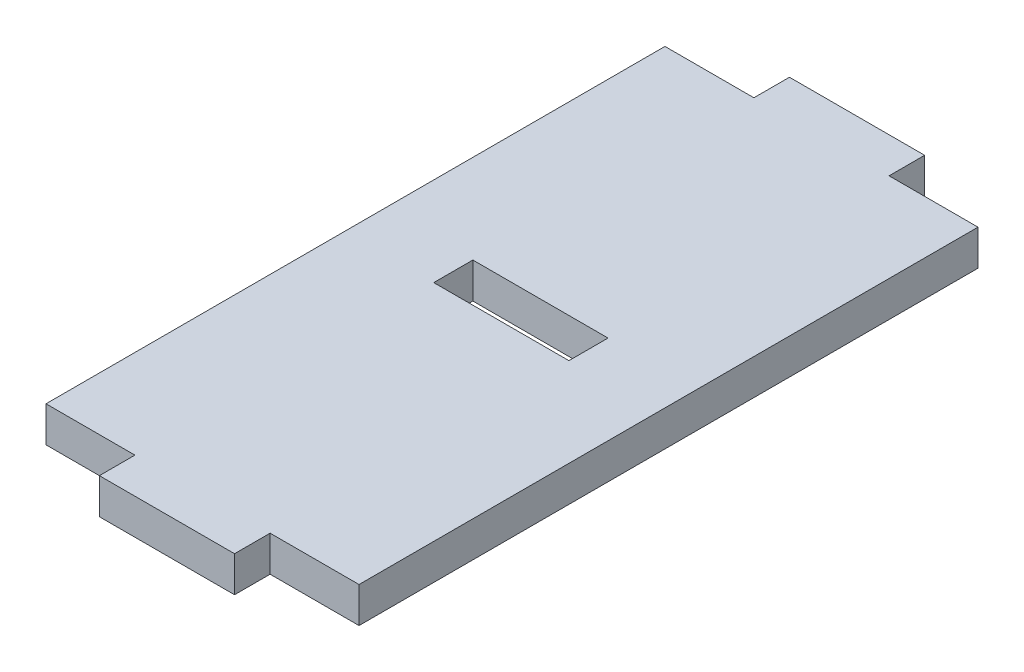
from build123d import *

# Parameters (mm, degrees)
SKETCH_1_W      = 7.6
SKETCH_1_H      = 2.2
EXTRUDE_1_DEPTH = 2


with BuildPart() as part:
    # 草图1 → 凸台-拉伸1 (new body)
    with BuildSketch(Plane(origin=(0, 0, 0), x_dir=(1, 0, 0), z_dir=(0, 1, 0))):
        Polygon((0, 34.8), (0, 0), (5, 0), (5, -2), (12.6, -2), (12.6, 0), (17.6, 0), (17.6, 34.8), (12.6, 34.8), (12.6, 36.8), (5, 36.8), (5, 34.8), align=None)
        with Locations((8.8, 17.9)):
            Rectangle(SKETCH_1_W, SKETCH_1_H, mode=Mode.SUBTRACT)
    extrude(amount=EXTRUDE_1_DEPTH)


solid = part.part
